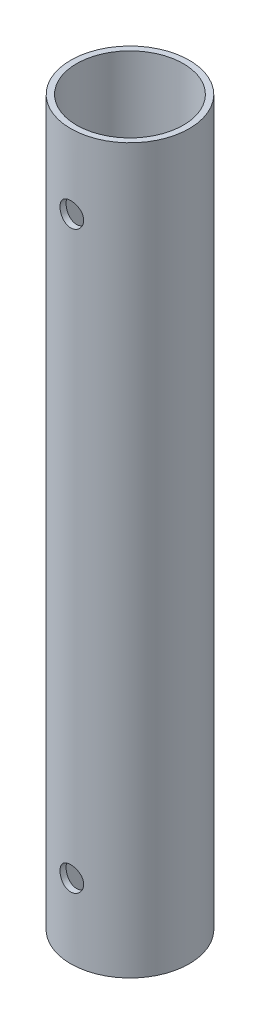
from build123d import *

# Parameters (mm, degrees)
SKETCH1_R           = 10
SKETCH1_R_2         = 9
BOSS_EXTRUDE1_DEPTH = 122
SKETCH3_R           = 2
CUT_EXTRUDE2_DEPTH  = 125.03225387


with BuildPart() as part:
    # Sketch1 → Boss-Extrude1 (new body)
    with BuildSketch(Plane(origin=(0, 0, 0), x_dir=(1, 0, 0), z_dir=(0, 1, 0))):
        Circle(SKETCH1_R)
        Circle(SKETCH1_R_2, mode=Mode.SUBTRACT)
    extrude(amount=BOSS_EXTRUDE1_DEPTH)

    # Sketch3 → Cut-Extrude2 (cut, through all)
    with BuildSketch(Plane.XY.offset(10)):
        with Locations((0, 109.5)):
            Circle(SKETCH3_R)
        with Locations((0, 12.5)):
            Circle(SKETCH3_R)
    extrude(amount=-CUT_EXTRUDE2_DEPTH, mode=Mode.SUBTRACT)


solid = part.part
